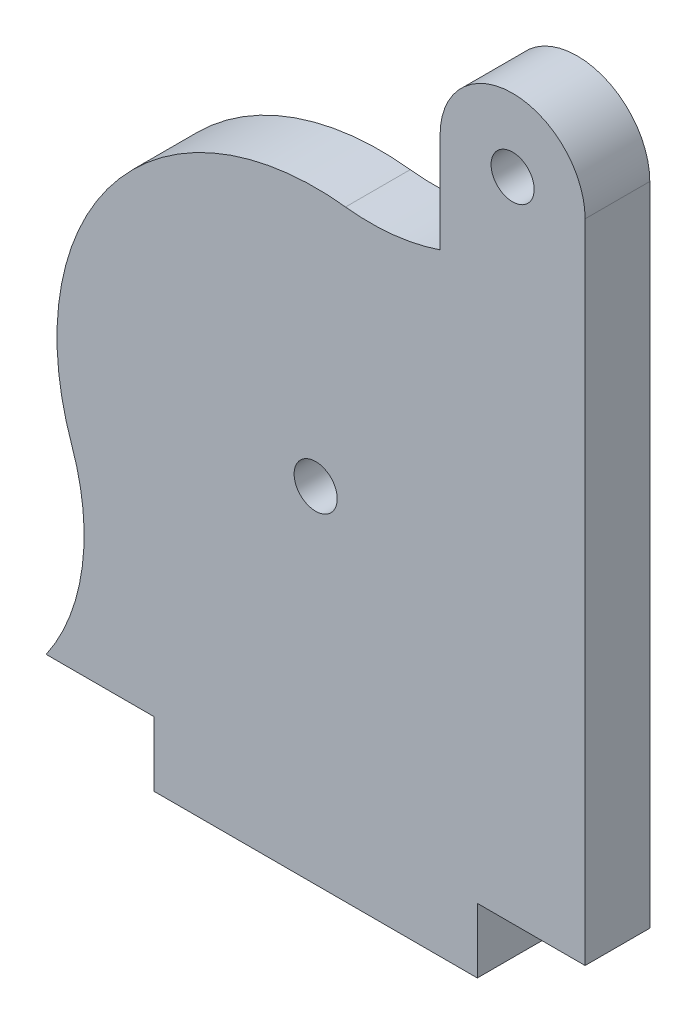
from build123d import *

# Parameters (mm, degrees)
SKETCH1_R           = 1
BOSS_EXTRUDE1_DEPTH = 3
FILLET2_R           = 10


with BuildPart() as part:
    # Sketch1 → Boss-Extrude1 (new body)
    with BuildSketch(Plane.XY):
        with BuildLine():
            Line((0, 0), (5, 0))
            Line((5, 0), (5, -3))
            Line((5, -3), (20, -3))
            Line((20, -3), (20, 0))
            Line((20, 0), (25, 0))
            Line((25, 0), (25, 30))
            ThreePointArc((25, 30), (21.635660943, 33.364339057), (18.271321885, 30))
            Line((18.271321885, 30), (18.271321885, 25.388028695))
            Line((18.271321885, 25.388028695), (17.277972917, 24.007768839))
            ThreePointArc((17.277972917, 24.007768839), (2.760122096, 20.009620418), (3.579412381, 4.97359878))
            Line((3.579412381, 4.97359878), (0, 0))
        make_face()
        with Locations((12.5, 13)):
            Circle(SKETCH1_R, mode=Mode.SUBTRACT)
        with Locations((21.635660943, 30)):
            Circle(SKETCH1_R, mode=Mode.SUBTRACT)
    extrude(amount=BOSS_EXTRUDE1_DEPTH)

    # Fillet2
    # the kernel refuses this fillet: 10 mm, written as the material it adds along each edge
    with BuildSketch(Plane(origin=(3.579412381, 4.97359878, 0), x_dir=(-0.5841350348464551, -0.8116564920364591, 0), z_dir=(0, 0, 1))) as fillet2_piece_1_section:
        with BuildLine():
            CenterArc((6.344003322, -9.997660671), FILLET2_R, 91.239343662, 53.979959966)
            Line((-1.869411105, -4.293291867), (-2.033679393, -4.179204491))
            ThreePointArc((-2.033679393, -4.179204491), (-0.906628796, -2.158871285), (-0.19542514, 0.042532512))
            Line((-0.19542514, 0.042532512), (0, 0.2))
            ThreePointArc((0, 0.2), (3.063856958, 0.2), (6.123388127, 0.199953213))
            Line((6.123388127, 0.199953213), (6.127713915, 0))
        make_face()
    fillet2_piece_1 = extrude(amount=3, mode=Mode.PRIVATE)
    fillet2_piece_1 = split(fillet2_piece_1, bisect_by=Plane(origin=(2.134897735, 0, 1.5), z_dir=(0, 1, 0)), keep=Keep.TOP, mode=Mode.PRIVATE)
    add(fillet2_piece_1)
    with BuildSketch(Plane(origin=(17.277972917, 24.007768839, 0), x_dir=(0.5841350348464545, 0.8116564920364596, 0), z_dir=(0, 0, 1))) as fillet2_piece_2:
        with BuildLine():
            CenterArc((7.496633226, 8.148949762), FILLET2_R, 209.104536821, 25.472441877)
            Line((-1.240703884, 3.284904099), (-1.415450626, 3.187623185))
            ThreePointArc((-1.415450626, 3.187623185), (-0.686649014, 1.617411734), (-0.19542514, -0.042532512))
            Line((-0.19542514, -0.042532512), (0, -0.2))
            ThreePointArc((0, -0.2), (0.850273404, -0.2), (1.584625079, -0.162978995))
            Line((1.584625079, -0.162978995), (1.700546807, 0))
        make_face()
    extrude(amount=3)


solid = part.part
